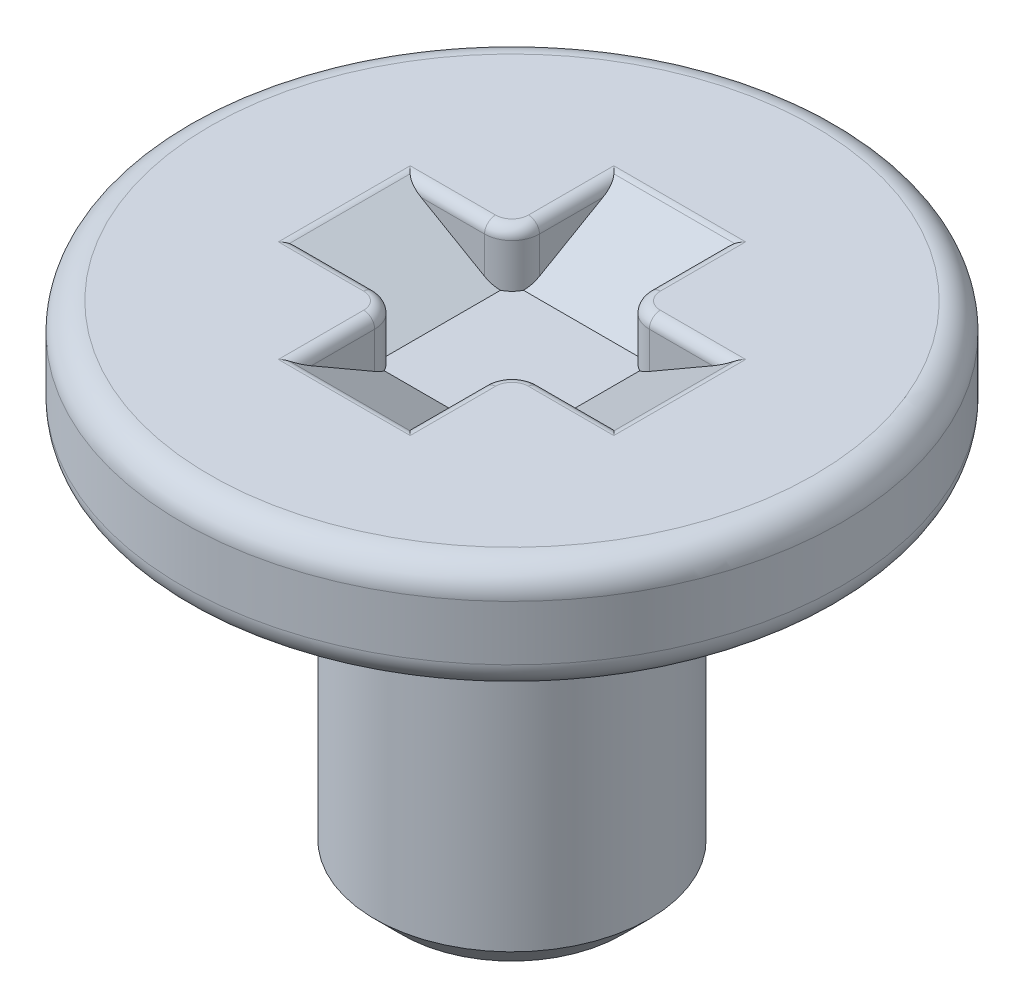
from build123d import *

# Parameters (mm, degrees)
CUT_EXTRUDE1_DEPTH = 0.5
CHAMFER1_SIZE      = 0.5
CHAMFER1_SIZE_2    = 0.866025404
FILLET1_R          = 0.25
FILLET2_R          = 0.1
FILLET3_R          = 0.25
CHAMFER2_SIZE      = 0.25


with BuildPart() as part:
    # Sketch1 → Revolve1 (revolve)
    with BuildSketch(Plane.XY):
        Polygon((0, 0), (3, 0), (3, -1), (1.25, -1), (1.25, -4.5), (0, -4.5), align=None)
    revolve(axis=Axis((0, -217.245924753, 0), (0, 1, 0)))

    # Sketch2 → Cut-Extrude1 (cut)
    with BuildSketch(Plane(origin=(0, 0, 0), x_dir=(1, 0, 0), z_dir=(0, 1, 0))):
        Polygon((-0.5, 0.5), (-0.5, 1.5), (0.5, 1.5), (0.5, 0.5), (1.5, 0.5), (1.5, -0.5), (0.5, -0.5), (0.5, -1.5), (-0.5, -1.5), (-0.5, -0.5), (-1.5, -0.5), (-1.5, 0.5), align=None)
    extrude(amount=-CUT_EXTRUDE1_DEPTH, mode=Mode.SUBTRACT)

    # Chamfer1
    # the kernel refuses this chamfer: 0.866025404, 0.5 mm, written as the material it adds along each edge
    with BuildSketch(Plane(origin=(-1.5, -0.5, 0.5), x_dir=(-0.0578938624026749, 0.9983227437537924, 0), z_dir=(0, 0, -1)), Plane(origin=(0.5, -0.5, 1.5), x_dir=(-3.4244955923263397e-15, 0.9983227437537926, 0.057893862402671484), z_dir=(-1, 0, 0)), Plane(origin=(1.5, -0.5, -0.5), x_dir=(0.057893862402667626, 0.9983227437537928, 0), z_dir=(0, 0, 1)), Plane(origin=(-0.5, -0.5, -1.5), x_dir=(-3.4244955923263397e-15, 0.9983227437537926, -0.057893862402671484), z_dir=(1, 0, 0))) as chamfer1_piece_1:
        Polygon((CHAMFER1_SIZE * 0.998322743754, CHAMFER1_SIZE * 0.0578938624027), (-CHAMFER1_SIZE_2 * 0.0578938623883, CHAMFER1_SIZE_2 * 0.998322743505), (0, 0), align=None)
    extrude(amount=1)

    # Fillet1
    # the kernel refuses this fillet: 0.25 mm, written as the material it takes off along each edge
    with BuildSketch(Plane(origin=(-0.5, 0.625, 0.5), x_dir=(-1, 0, 0), z_dir=(0, -1, 0))) as fillet1_piece_1_section:
        with BuildLine():
            CenterArc((FILLET1_R, -FILLET1_R), FILLET1_R, 90, 90)
            Line((0, -FILLET1_R), (0, 0))
            Line((0, 0), (FILLET1_R, 0))
        make_face()
    fillet1_piece_1 = extrude(amount=1.125, mode=Mode.PRIVATE)
    fillet1_piece_1 = split(fillet1_piece_1, bisect_by=Plane(origin=(-0.82036424, -0.392387889, 0.556422311), z_dir=(0.4999999999999566, 0.8660254037844637, 0)), keep=Keep.TOP, mode=Mode.PRIVATE)
    fillet1_piece_1 = split(fillet1_piece_1, bisect_by=Plane(origin=(-0.556422311, -0.392387889, 0.82036424), z_dir=(0, 0.8660254037844637, -0.4999999999999566)), keep=Keep.TOP, mode=Mode.PRIVATE)
    add(fillet1_piece_1, mode=Mode.SUBTRACT)
    with BuildSketch(Plane(origin=(-0.5, 0.625, -0.5), x_dir=(-1, 0, 0), z_dir=(0, -1, 0))) as fillet1_piece_2_section:
        with BuildLine():
            CenterArc((FILLET1_R, FILLET1_R), FILLET1_R, 180, 90)
            Line((0, FILLET1_R), (0, 0))
            Line((0, 0), (FILLET1_R, 0))
        make_face()
    fillet1_piece_2 = extrude(amount=1.125, mode=Mode.PRIVATE)
    fillet1_piece_2 = split(fillet1_piece_2, bisect_by=Plane(origin=(-0.82036424, -0.392387889, -0.556422311), z_dir=(0.4999999999999566, 0.8660254037844637, 0)), keep=Keep.TOP, mode=Mode.PRIVATE)
    fillet1_piece_2 = split(fillet1_piece_2, bisect_by=Plane(origin=(-0.556422311, -0.392387889, -0.82036424), z_dir=(0, 0.8660254037844637, 0.4999999999999566)), keep=Keep.TOP, mode=Mode.PRIVATE)
    add(fillet1_piece_2, mode=Mode.SUBTRACT)
    with BuildSketch(Plane(origin=(0.5, 0.625, 0.5), x_dir=(1, 0, 0), z_dir=(0, -1, 0))) as fillet1_piece_3_section:
        with BuildLine():
            CenterArc((FILLET1_R, FILLET1_R), FILLET1_R, 180, 90)
            Line((0, FILLET1_R), (0, 0))
            Line((0, 0), (FILLET1_R, 0))
        make_face()
    fillet1_piece_3 = extrude(amount=1.125, mode=Mode.PRIVATE)
    fillet1_piece_3 = split(fillet1_piece_3, bisect_by=Plane(origin=(0.82036424, -0.392387889, 0.556422311), z_dir=(-0.4999999999999566, 0.8660254037844637, 0)), keep=Keep.TOP, mode=Mode.PRIVATE)
    fillet1_piece_3 = split(fillet1_piece_3, bisect_by=Plane(origin=(0.556422311, -0.392387889, 0.82036424), z_dir=(0, 0.8660254037844637, -0.4999999999999566)), keep=Keep.TOP, mode=Mode.PRIVATE)
    add(fillet1_piece_3, mode=Mode.SUBTRACT)
    with BuildSketch(Plane(origin=(0.5, 0.625, -0.5), x_dir=(0, 0, -1), z_dir=(0, -1, 0))) as fillet1_piece_4_section:
        with BuildLine():
            CenterArc((FILLET1_R, FILLET1_R), FILLET1_R, 180, 90)
            Line((0, FILLET1_R), (0, 0))
            Line((0, 0), (FILLET1_R, 0))
        make_face()
    fillet1_piece_4 = extrude(amount=1.125, mode=Mode.PRIVATE)
    fillet1_piece_4 = split(fillet1_piece_4, bisect_by=Plane(origin=(0.556422311, -0.392387889, -0.82036424), z_dir=(0, 0.8660254037844637, 0.4999999999999566)), keep=Keep.TOP, mode=Mode.PRIVATE)
    fillet1_piece_4 = split(fillet1_piece_4, bisect_by=Plane(origin=(0.82036424, -0.392387889, -0.556422311), z_dir=(-0.4999999999999566, 0.8660254037844637, 0)), keep=Keep.TOP, mode=Mode.PRIVATE)
    add(fillet1_piece_4, mode=Mode.SUBTRACT)

    # Fillet2
    fillet2_edges = [part.edges().sort_by_distance(p)[0] for p in [
        (-1.5, 0, 0),
        (-1.125, 0, 0.5),
        (0, 0, 1.5),
        (0.5, 0, 1.125),
        (1.5, 0, 0),
        (1.125, 0, -0.5),
        (0, 0, -1.5),
        (-0.5, 0, -1.125),
        (-0.5, 0, 1.125),
        (-1.125, 0, -0.5),
        (0.5, 0, -1.125),
        (1.125, 0, 0.5),
        (0.573223305, 0, -0.573223305),
        (0.573223305, 0, 0.573223305),
        (-0.573223305, 0, -0.573223305),
        (-0.573223305, 0, 0.573223305),
    ]]
    fillet(fillet2_edges, radius=FILLET2_R)

    # Fillet3
    fillet3_edges = [part.edges().sort_by_distance(p)[0] for p in [
        (-3, -1, 0),
        (-3, 0, 0),
    ]]
    fillet(fillet3_edges, radius=FILLET3_R)

    # Chamfer2
    chamfer2_edges = [part.edges().sort_by_distance(p)[0] for p in [
        (-1.25, -4.5, 0),
    ]]
    chamfer(chamfer2_edges, length=CHAMFER2_SIZE)


solid = part.part
